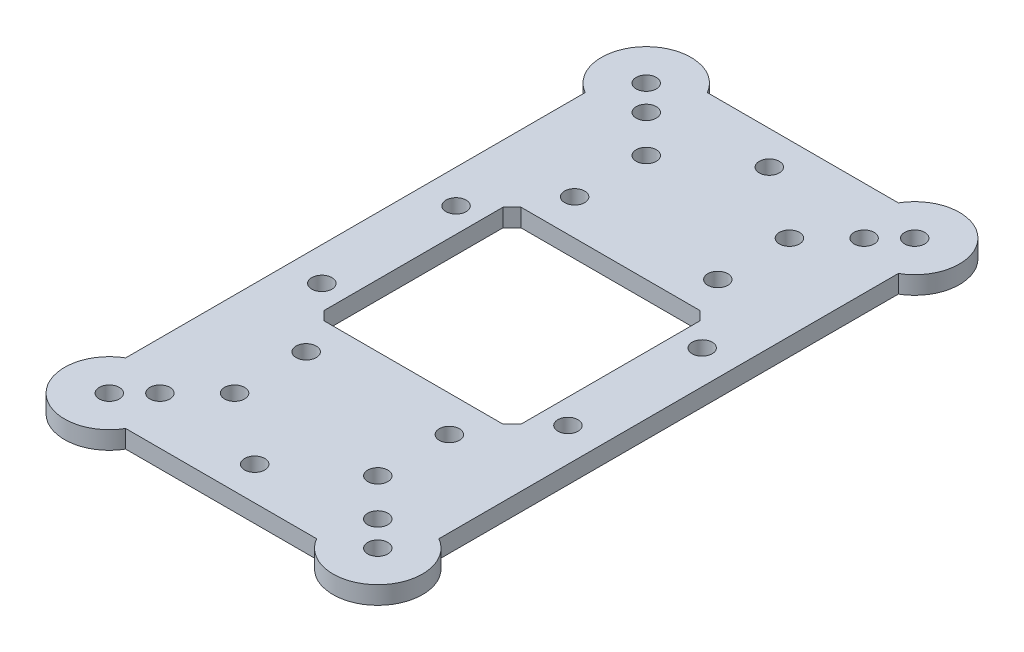
from build123d import *

# Parameters (mm, degrees)
SKETCH1_R          = 2.25
BASE_FLANGE1_DEPTH = 4
CUT_EXTRUDE1_REACH = 82.722
SKETCH5_R          = 2.25
CUT_EXTRUDE2_DEPTH = 81.721744282
SKETCH6_R          = 2.25
CUT_EXTRUDE3_DEPTH = 81.721744282
SKETCH7_W          = 5
SKETCH7_H          = 102.679491924
SKETCH7_W_2        = 42.679491924
SKETCH7_H_2        = 5
TAB1_DEPTH         = 4
SKETCH8_R          = 2.25
CUT_EXTRUDE4_DEPTH = 81.721744282
SKETCH9_R          = 2.25
CUT_EXTRUDE5_DEPTH = 81.721744282


# Sheet-metal steps are written as plain solids
with BuildPart() as part:
    # Sketch1 → Base-Flange1 (new body)
    with BuildSketch(Plane(origin=(0, 0, 0), x_dir=(1, 0, 0), z_dir=(0, 1, 0))):
        with BuildLine():
            Line((-30, 0), (-30, 42.679491924))
            ThreePointArc((-30, 42.679491924), (-31.339745962, 47.679491924), (-35, 51.339745962))
            ThreePointArc((-35, 51.339745962), (-37.071067812, 67.071067812), (-21.339745962, 65))
            ThreePointArc((-21.339745962, 65), (-17.679491924, 61.339745962), (-12.679491924, 60))
            Line((-12.679491924, 60), (0, 60))
            Line((0, 60), (12.679491924, 60))
            ThreePointArc((12.679491924, 60), (17.679491924, 61.339745962), (21.339745962, 65))
            ThreePointArc((21.339745962, 65), (37.071067812, 67.071067812), (35, 51.339745962))
            ThreePointArc((35, 51.339745962), (31.339745962, 47.679491924), (30, 42.679491924))
            Line((30, 42.679491924), (30, 0))
            Line((30, 0), (30, -42.679491924))
            ThreePointArc((30, -42.679491924), (31.339745962, -47.679491924), (35, -51.339745962))
            ThreePointArc((35, -51.339745962), (37.071067812, -67.071067812), (21.339745962, -65))
            ThreePointArc((21.339745962, -65), (17.679491924, -61.339745962), (12.679491924, -60))
            Line((12.679491924, -60), (0, -60))
            Line((0, -60), (-12.679491924, -60))
            ThreePointArc((-12.679491924, -60), (-17.679491924, -61.339745962), (-21.339745962, -65))
            ThreePointArc((-21.339745962, -65), (-37.071067812, -67.071067812), (-35, -51.339745962))
            ThreePointArc((-35, -51.339745962), (-31.339745962, -47.679491924), (-30, -42.679491924))
            Line((-30, -42.679491924), (-30, 0))
        make_face()
        with Locations(Location((-30, 60, 0), (0, 0, 270))):
            Circle(SKETCH1_R, mode=Mode.SUBTRACT)
        with Locations(Location((30, 60, 0), (0, 0, 270))):
            Circle(SKETCH1_R, mode=Mode.SUBTRACT)
        with Locations(Location((30, -60, 0), (0, 0, 270))):
            Circle(SKETCH1_R, mode=Mode.SUBTRACT)
        with Locations(Location((-30, -60, 0), (0, 0, 270))):
            Circle(SKETCH1_R, mode=Mode.SUBTRACT)
    extrude(amount=-BASE_FLANGE1_DEPTH)

    # Sketch4 → Cut-Extrude1 (cut, up to next)
    with BuildSketch(Plane(origin=(0, 0, 0), x_dir=(1, 0, 0), z_dir=(0, 1, 0)), mode=Mode.PRIVATE) as cut_extrude1_sk1:
        Polygon((-20, 22), (20, 22), (22, 20), (22, -20), (20, -22), (-20, -22), (-22, -20), (-22, 20), align=None)
    cut_extrude1_tool1 = extrude(cut_extrude1_sk1.sketch, amount=-CUT_EXTRUDE1_REACH, mode=Mode.PRIVATE) & part.part
    add(cut_extrude1_tool1.solids().sort_by_distance((0, 0, 0))[0], mode=Mode.SUBTRACT)

    # Sketch5 → Cut-Extrude2 (cut, through all)
    with BuildSketch(Plane.XZ.offset(4)):
        with Locations(Location((-24.343145751, 54.343145751, 0), (0, 0, 270))):
            Circle(SKETCH5_R)
        with Locations(Location((24.343145751, 54.343145751, 0), (0, 0, 270))):
            Circle(SKETCH5_R)
        with Locations(Location((24.343145751, -54.343145751, 0), (0, 0, 270))):
            Circle(SKETCH5_R)
        with Locations(Location((-24.343145751, -54.343145751, 0), (0, 0, 270))):
            Circle(SKETCH5_R)
    extrude(amount=-CUT_EXTRUDE2_DEPTH, mode=Mode.SUBTRACT)

    # Sketch6 → Cut-Extrude3 (cut, through all)
    with BuildSketch(Plane.XZ.offset(4)):
        with Locations(Location((-27.5, -15, 0), (0, 0, 270))):
            Circle(SKETCH6_R)
        with Locations(Location((-27.5, 15, 0), (0, 0, 270))):
            Circle(SKETCH6_R)
        with Locations(Location((27.5, 15, 0), (0, 0, 270))):
            Circle(SKETCH6_R)
        with Locations(Location((27.5, -15, 0), (0, 0, 270))):
            Circle(SKETCH6_R)
    extrude(amount=-CUT_EXTRUDE3_DEPTH, mode=Mode.SUBTRACT)

    # Sketch7 → Tab1 (add)
    with BuildSketch(Plane(origin=(0, 0, 0), x_dir=(1, 0, 0), z_dir=(0, 1, 0))):
        with Locations((-32.5, 0)):
            Rectangle(SKETCH7_W, SKETCH7_H)
        with Locations((32.5, 0)):
            Rectangle(SKETCH7_W, SKETCH7_H)
        with Locations((0, -62.5)):
            Rectangle(SKETCH7_W_2, SKETCH7_H_2)
        with Locations((0, 62.5)):
            Rectangle(SKETCH7_W_2, SKETCH7_H_2)
    extrude(amount=-TAB1_DEPTH)

    # Sketch8 → Cut-Extrude4 (cut, through all)
    with BuildSketch(Plane.XZ.offset(4)):
        with Locations(Location((-16, 46, 0), (0, 0, 270))):
            Circle(SKETCH8_R)
        with Locations(Location((-16, 30, 0), (0, 0, 270))):
            Circle(SKETCH8_R)
        with Locations(Location((16, 46, 0), (0, 0, 270))):
            Circle(SKETCH8_R)
        with Locations(Location((16, 30, 0), (0, 0, 270))):
            Circle(SKETCH8_R)
        with Locations(Location((16, -30, 0), (0, 0, 90))):
            Circle(SKETCH8_R)
        with Locations(Location((16, -46, 0), (0, 0, 90))):
            Circle(SKETCH8_R)
        with Locations(Location((-16, -30, 0), (0, 0, 90))):
            Circle(SKETCH8_R)
        with Locations(Location((-16, -46, 0), (0, 0, 90))):
            Circle(SKETCH8_R)
    extrude(amount=-CUT_EXTRUDE4_DEPTH, mode=Mode.SUBTRACT)

    # Sketch9 → Cut-Extrude5 (cut, through all)
    with BuildSketch(Plane(origin=(0, 0, 0), x_dir=(1, 0, 0), z_dir=(0, 1, 0))):
        with Locations(Location((0, 57.5, 0), (0, 0, 270))):
            Circle(SKETCH9_R)
        with Locations(Location((0, -57.5, 0), (0, 0, 270))):
            Circle(SKETCH9_R)
    extrude(amount=-CUT_EXTRUDE5_DEPTH, mode=Mode.SUBTRACT)


solid = part.part
